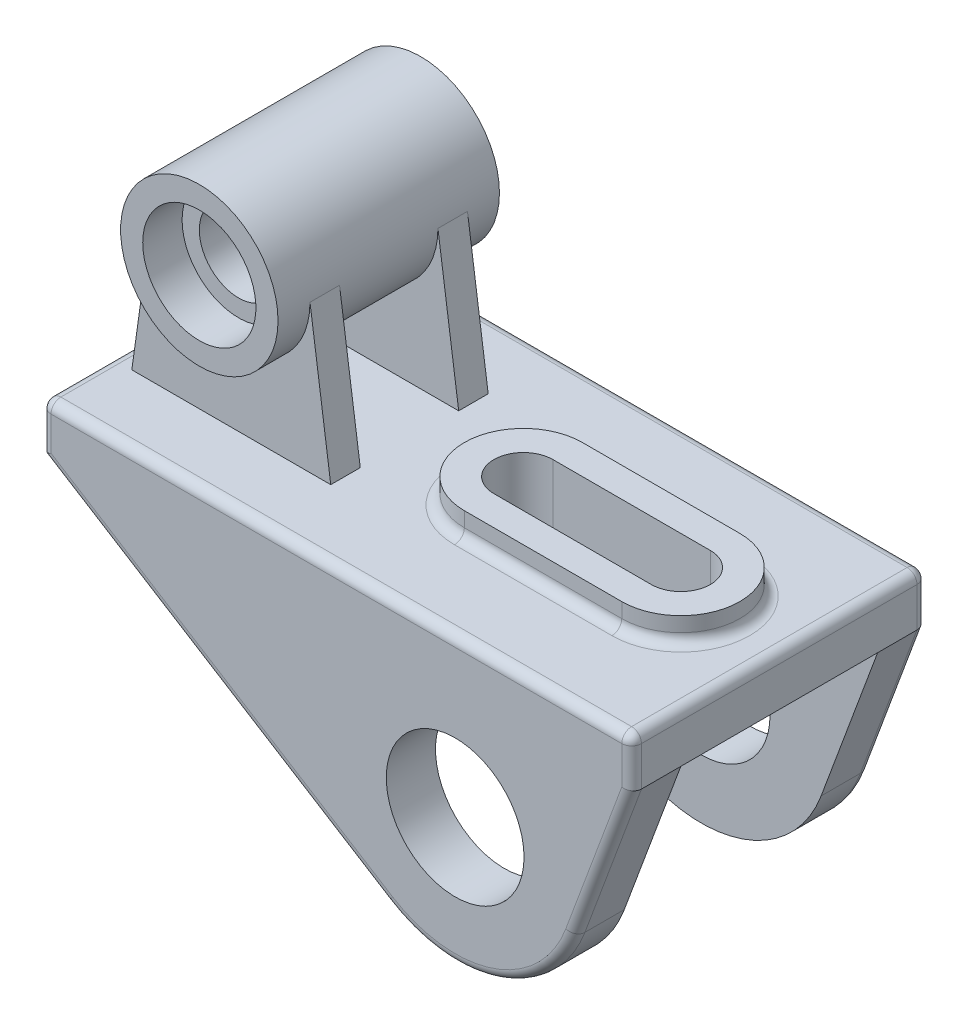
from build123d import *

# Parameters (mm, degrees)
SKETCH1_W                  = 120
SKETCH1_H                  = 60
BOSS_EXTRUDE1_DEPTH        = 10
BOSS_EXTRUDE2_DEPTH        = 10
F_25_0_28_DIAMETER_HOLE1_D = 28
BOSS_EXTRUDE3_DEPTH        = 5
CUT_EXTRUDE1_DEPTH         = 147.130542204
SKETCH7_R                  = 11.5
BOSS_EXTRUDE4_DEPTH        = 22.5
BOSS_EXTRUDE5_DEPTH        = 16
CUT_EXTRUDE2_DEPTH         = 10
BOSS_EXTRUDE6_DEPTH        = 14.5
BOSS_EXTRUDE6_DEPTH_BACK   = 22.5
SKETCH7_7_R                = 11.5
SKETCH7_7_R_2              = 8
FILLET1_R                  = 2


with BuildPart() as part:
    # Sketch1 → Boss-Extrude1 (new body)
    with BuildSketch(Plane(origin=(0, 0, 0), x_dir=(1, 0, 0), z_dir=(0, 1, 0))):
        with Locations((60, 30)):
            Rectangle(SKETCH1_W, SKETCH1_H)
    extrude(amount=BOSS_EXTRUDE1_DEPTH)

    # Sketch2 → Boss-Extrude2 (add)
    with BuildSketch(Plane.XY):
        with BuildLine():
            Line((0, 10), (0, 0))
            Line((0, 0), (70.357344256, -43.964148108))
            ThreePointArc((70.357344256, -43.964148108), (92.522919584, -46.524792309), (108.511026917, -30.960408214))
            Line((108.511026917, -30.960408214), (120, 0))
            Line((120, 0), (120, 10))
            Line((120, 10), (0, 10))
        make_face()
    boss_extrude2 = extrude(amount=-BOSS_EXTRUDE2_DEPTH)

    # Mirror1: Boss-Extrude2 across plane
    add(boss_extrude2.mirror(Plane.XY.offset(-30)))

    # Ø25.0 (28) Diameter Hole1 (through all)
    with Locations(Plane(origin=(84.135245127, -21.914897608, 0), x_dir=(1, 0, 0), z_dir=(0, 0, 1))):
        with Locations((0, 0)):
            Hole(F_25_0_28_DIAMETER_HOLE1_D / 2)

    # Sketch5 → Boss-Extrude3 (add)
    with BuildSketch(Plane(origin=(0, 10, 0), x_dir=(1, 0, 0), z_dir=(0, 1, 0))):
        with BuildLine():
            Line((100, 18), (68, 18))
            ThreePointArc((68, 18), (56, 30), (68, 42))
            Line((68, 42), (100, 42))
            ThreePointArc((100, 42), (112, 30), (100, 18))
        make_face()
        with BuildLine():
            Line((100, 24), (68, 24))
            ThreePointArc((68, 24), (62, 30), (68, 36))
            Line((68, 36), (100, 36))
            ThreePointArc((100, 36), (106, 30), (100, 24))
        make_face(mode=Mode.SUBTRACT)
    extrude(amount=BOSS_EXTRUDE3_DEPTH)

    # Sketch5<2> → Cut-Extrude1 (cut, through all)
    with BuildSketch(Plane(origin=(0, 10, 0), x_dir=(1, 0, 0), z_dir=(0, 1, 0))):
        with BuildLine():
            Line((68, 24), (100, 24))
            ThreePointArc((100, 24), (106, 30), (100, 36))
            Line((100, 36), (68, 36))
            ThreePointArc((68, 36), (62, 30), (68, 24))
        make_face()
    extrude(amount=-CUT_EXTRUDE1_DEPTH, mode=Mode.SUBTRACT)



with BuildPart() as body_2:
    # Sketch7 → Boss-Extrude4 (new, symmetric)
    with BuildSketch(Plane.XY.offset(-30)):
        with BuildLine():
            ThreePointArc((40.635783634, 40), (24.635783634, 56), (8.635783634, 40))
            ThreePointArc((8.635783634, 40), (24.635783634, 24), (40.635783634, 40))
        make_face()
        with Locations((24.635783634, 40)):
            Circle(SKETCH7_R, mode=Mode.SUBTRACT)
    extrude(amount=BOSS_EXTRUDE4_DEPTH, both=True)


with BuildPart() as part_1:
    add(part.part)

    add(body_2.part)  # Boss-Extrude5 merges body 2
    # Sketch7<3> → Boss-Extrude5 (add, symmetric)
    with BuildSketch(Plane.XY.offset(-30)):
        with BuildLine():
            Line((8.635783634, 40), (4.419558593, 10))
            Line((4.419558593, 10), (44.852008675, 10))
            Line((44.852008675, 10), (40.635783634, 40))
            ThreePointArc((40.635783634, 40), (24.635783634, 24), (8.635783634, 40))
        make_face()
    extrude(amount=BOSS_EXTRUDE5_DEPTH, both=True)

    # Sketch7<5> → Cut-Extrude2 (cut, symmetric)
    with BuildSketch(Plane.XY.offset(-30)):
        with BuildLine():
            Line((8.635783634, 40), (4.419558593, 10))
            Line((4.419558593, 10), (44.852008675, 10))
            Line((44.852008675, 10), (40.635783634, 40))
            ThreePointArc((40.635783634, 40), (24.635783634, 24), (8.635783634, 40))
        make_face()
    extrude(amount=CUT_EXTRUDE2_DEPTH, both=True, mode=Mode.SUBTRACT)

    # Sketch7<7> → Boss-Extrude6 (add, two sides: drawn at the far end of the back side and taken through both)
    with BuildSketch(Plane.XY.offset(-30).offset(-BOSS_EXTRUDE6_DEPTH_BACK)):
        with Locations((24.635783634, 40)):
            Circle(SKETCH7_7_R)
        with Locations((24.635783634, 40)):
            Circle(SKETCH7_7_R_2, mode=Mode.SUBTRACT)
    extrude(amount=BOSS_EXTRUDE6_DEPTH + BOSS_EXTRUDE6_DEPTH_BACK)

    # Fillet1
    fillet1_edges = [part_1.edges().sort_by_distance(p)[0] for p in [
        (114.255513458, -15.480204107, -60),
        (92.522919584, -46.524792309, -60),
        (114.255513458, -15.480204107, 0),
        (92.522919584, -46.524792309, 0),
        (84, 10, -18),
        (56, 10, -30),
        (84, 10, -42),
        (120, 5, -60),
        (120, 5, 0),
        (0, 5, -60),
        (35.178672128, -21.982074054, -60),
        (0, 5, 0),
        (35.178672128, -21.982074054, 0),
        (60, 10, -60),
        (0, 10, -30),
        (120, 10, -30),
        (60, 10, 0),
        (112, 10, -30),
    ]]
    fillet(fillet1_edges, radius=FILLET1_R)


solid = part_1.part
